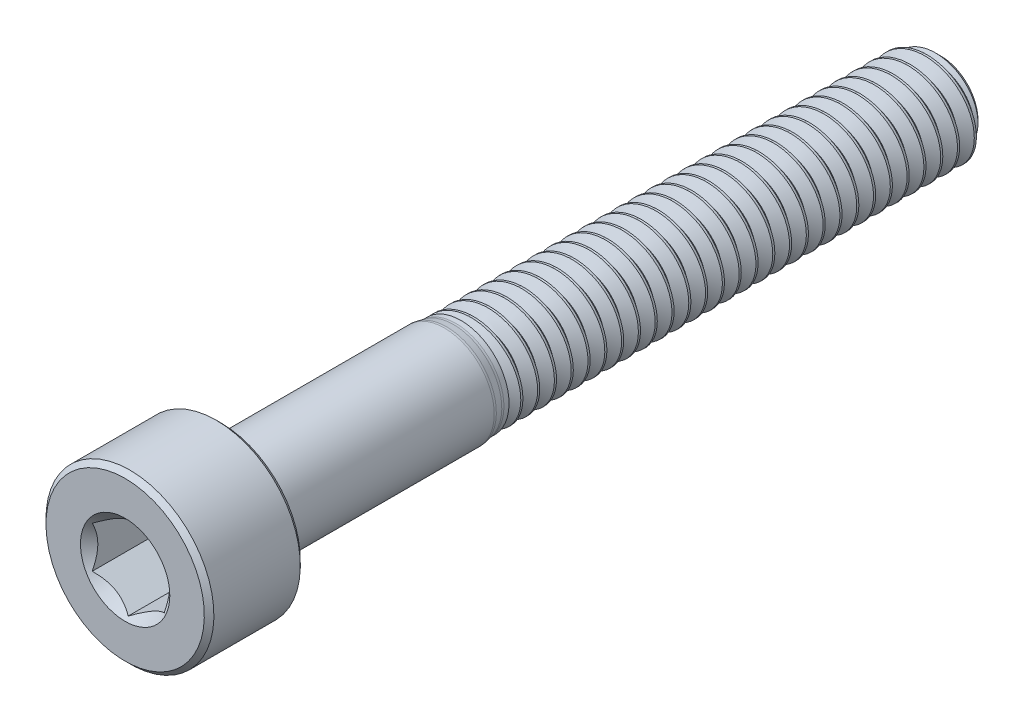
from build123d import *

# Parameters (mm, degrees)
CUT_EXTRUDE1_DEPTH     = 3
SPLIT1_SURFACE_1_BACK  = 36.412
SPLIT1_SURFACE_1_DEPTH = 72.824
SPLIT1_SURFACE_2_BACK  = 36.412
SPLIT1_SURFACE_2_DEPTH = 72.824
CUT_SWEEP1_PITCH       = 0.7
CUT_SWEEP1_TO          = 20


with BuildPart() as part:
    # Sketch2 → Revolve1 (revolve)
    with BuildSketch(Plane(origin=(0, 0, 0), x_dir=(0, 0, -1), z_dir=(1, 0, 0))):
        with BuildLine():
            Line((-17, 0), (-17, 3.3))
            Line((-17, 3.3), (-16.8, 3.5))
            Line((-16.8, 3.5), (-13.2, 3.5))
            Line((-13.2, 3.5), (-13, 3.3))
            Line((-13, 3.3), (-13, 2.275777223))
            ThreePointArc((-13, 2.275777223), (-12.941421356, 2.134355867), (-12.8, 2.075777223))
            Line((-12.8, 2.075777223), (-3.692703527, 2.075777223))
            ThreePointArc((-3.692703527, 2.075777223), (-3.643694956, 2.073369586), (-3.595158366, 2.066169863))
            Line((-3.595158366, 2.066169863), (-3.310799459, 2.00960736))
            ThreePointArc((-3.310799459, 2.00960736), (-3.262262868, 2.002407637), (-3.213254298, 2))
            Line((-3.213254298, 2), (16.545336663, 2))
            Line((16.545336663, 2), (17, 1.545336663))
            Line((17, 1.545336663), (17, 0))
            Line((17, 0), (-17, 0))
        make_face()
    revolve(axis=Axis((0, 0, -17), (0, 0, 1)))

    # Sketch3 → Cut-Extrude1 (cut)
    with BuildSketch(Plane.XY.offset(17)):
        Polygon((1.5, -0.866025404), (1.5, 0.866025404), (0, 1.732050808), (-1.5, 0.866025404), (-1.5, -0.866025404), (0, -1.732050808), align=None)
    extrude(amount=-CUT_EXTRUDE1_DEPTH, mode=Mode.SUBTRACT)

    # Cut-Extrude2 cone 1 section (through the dimple's axis) → Cut-Extrude2 (revolve, cut)
    with BuildSketch(Plane(origin=(0, 0, 17), x_dir=(0, -1, 0), z_dir=(1, 0, 0))):
        Polygon((0, 0), (1.861954618, 0), (0, 1.861954618), align=None)
    revolve(axis=Axis((0, 0, 17), (0, 0, -1)), mode=Mode.SUBTRACT)


with BuildPart() as body_2:
    # Split1: the piece behind the surface
    add(part.part)
    # Split1 surface: a surface, the sketch's curves swept straight by 72.824 mm
    with BuildLine(Plane(origin=(0, 0, 0), x_dir=(0, 0, -1), z_dir=(1, 0, 0)).offset(-SPLIT1_SURFACE_1_BACK), mode=Mode.PRIVATE) as split1_surface_1_path:
        Line((-3, -2), (-3, 2))
    split1_surface_1 = Shell.extrude(split1_surface_1_path.wire(), (1 * SPLIT1_SURFACE_1_DEPTH, 0 * SPLIT1_SURFACE_1_DEPTH, 0 * SPLIT1_SURFACE_1_DEPTH))
    split(bisect_by=split1_surface_1, keep=Keep.BOTTOM)

    # Cut-Sweep1: arcs per turn and ends read off the stored shape
    # Cut-Sweep1: the profile of Sketch7 screwed along a right-hand helix through 29.571429 turns, 6 arcs to a turn; built about Z, then put on its axis
    cut_sweep1_z = Axis((0, 0, 0), (0, 0, 1))
    cut_sweep1_corners = [(2.037888611, 0, 0.021875), (2.037888611, 0, -0.634375), (1.545336663, 0, -0.35), (1.545336663, 0, -0.2625)]
    with BuildLine(mode=Mode.PRIVATE) as cut_sweep1_profile:
        Line(cut_sweep1_corners[0], cut_sweep1_corners[1])
        Line(cut_sweep1_corners[1], cut_sweep1_corners[2])
        Line(cut_sweep1_corners[2], cut_sweep1_corners[3])
        Line(cut_sweep1_corners[3], cut_sweep1_corners[0])
    cut_sweep1_cap = Face(cut_sweep1_profile.wire())
    cut_sweep1_turn_angles = [0, 30, 60, 90, 120, 150, 180, 210, 240, 270, 300, 330, 360]
    cut_sweep1_turn_weights = [1, 0.8660254037844387, 1, 0.8660254037844387, 1, 0.8660254037844387, 1, 0.8660254037844387, 1, 0.8660254037844387, 1, 0.8660254037844387, 1]
    cut_sweep1_turn_rails = [Edge.make_bspline([Vector(p[0], p[1], 0).rotate(cut_sweep1_z, cut_sweep1_turn_angles[k]) / cut_sweep1_turn_weights[k] + Vector(0, 0, p[2] + CUT_SWEEP1_PITCH * cut_sweep1_turn_angles[k] / 360) for k in range(13)], [0, 0, 0, 1, 1, 2, 2, 3, 3, 4, 4, 5, 5, 6, 6, 6], 2, cut_sweep1_turn_weights) for p in cut_sweep1_corners]
    cut_sweep1_turn_sides = [Face.make_surface_from_curves(cut_sweep1_turn_rails[p[0]], cut_sweep1_turn_rails[p[1]]) for p in [(0, 1), (1, 2), (2, 3), (3, 0)]]
    cut_sweep1_last_angles = [10440, 10470, 10500, 10530, 10560, 10590, 10620, 10632.857142857, 10645.714285714]
    cut_sweep1_last_weights = [1, 0.8660254037844387, 1, 0.8660254037844387, 1, 0.8660254037844387, 1, 0.9749279121817342, 1]
    cut_sweep1_last_rails = [Edge.make_bspline([Vector(p[0], p[1], 0).rotate(cut_sweep1_z, cut_sweep1_last_angles[k]) / cut_sweep1_last_weights[k] + Vector(0, 0, p[2] + CUT_SWEEP1_PITCH * cut_sweep1_last_angles[k] / 360) for k in range(9)], [0, 0, 0, 1, 1, 2, 2, 3, 3, 4, 4, 4], 2, cut_sweep1_last_weights) for p in cut_sweep1_corners]
    cut_sweep1_last_sides = [Face.make_surface_from_curves(cut_sweep1_last_rails[p[0]], cut_sweep1_last_rails[p[1]]) for p in [(0, 1), (1, 2), (2, 3), (3, 0)]]
    cut_sweep1 = Plane(origin=(0, 0, -17), x_dir=(0, 1, 0), z_dir=(0, 0, 1)) * split(Solid(Shell([*[p.moved(Location((0, 0, CUT_SWEEP1_PITCH * i))) for i in range(29) for p in cut_sweep1_turn_sides], *cut_sweep1_last_sides, cut_sweep1_cap, cut_sweep1_cap.rotate(cut_sweep1_z, 10645.714285714).moved(Location((0, 0, CUT_SWEEP1_PITCH * 10645.714285714 / 360)))])), bisect_by=Plane.XY.offset(CUT_SWEEP1_TO), keep=Keep.BOTTOM, mode=Mode.PRIVATE)
    add(cut_sweep1, mode=Mode.SUBTRACT)


with BuildPart() as part_1:
    add(part.part)

    # Split1: split by a surface, the side it looks to stays
    # Split1 surface: a surface, the sketch's curves swept straight by 72.824 mm
    with BuildLine(Plane(origin=(0, 0, 0), x_dir=(0, 0, -1), z_dir=(1, 0, 0)).offset(-SPLIT1_SURFACE_2_BACK), mode=Mode.PRIVATE) as split1_surface_2_path:
        Line((-3, -2), (-3, 2))
    split1_surface_2 = Shell.extrude(split1_surface_2_path.wire(), (1 * SPLIT1_SURFACE_2_DEPTH, 0 * SPLIT1_SURFACE_2_DEPTH, 0 * SPLIT1_SURFACE_2_DEPTH))
    split(bisect_by=split1_surface_2, keep=Keep.TOP)

    add(body_2.part)  # Revolve2 merges body 2
    # Sketch8 → Revolve2 (revolve)
    with BuildSketch(Plane(origin=(0, 0, 0), x_dir=(0, 0, -1), z_dir=(1, 0, 0))):
        Polygon((-13, 0), (-13, 2), (-3, 2), (-1.845299462, 0), align=None)
    revolve(axis=Axis((0, 0, 1.845299462), (0, 0, 1)))


solid = part_1.part
